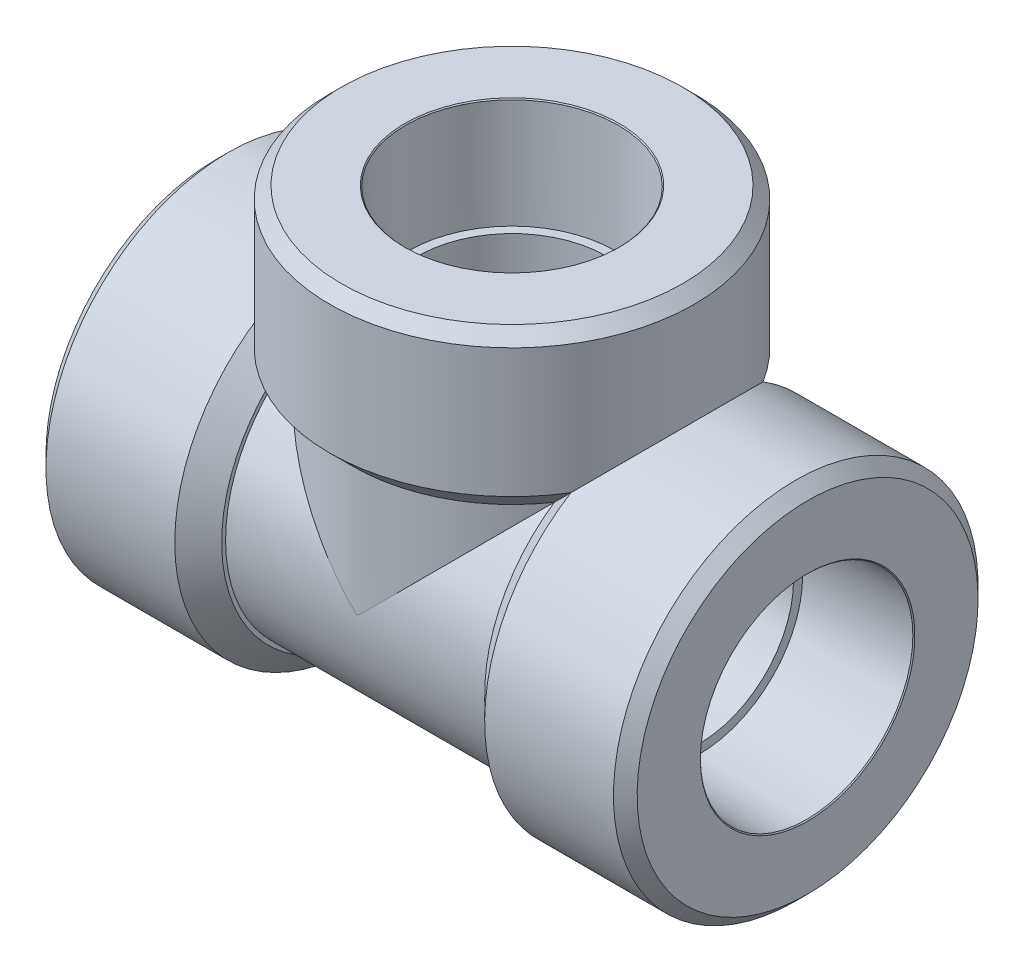
from build123d import *

# Parameters (mm, degrees)
LOFT1_START                 = -38.1
LOFT1_DEPTH                 = 76.2
SKETCH19_R                  = 19.97075
EXTRUDE1_DEPTH              = 38.1
CIRPATTERN1_COUNT           = 3
CIRPATTERN1_ANGLE           = 180
SKETCH10_R                  = 13.335
CUT_EXTRUDE1_DEPTH          = 77.656362587
CUT_EXTRUDE1_DRAFT          = 1.5
SKETCH16_R                  = 12.156586861
CUT_EXTRUDE4_DEPTH          = 24.13
CIRPATTERN2_COUNT           = 3
CIRPATTERN2_ANGLE           = 180
CIRPATTERN2_COPY_1_SKETCH_R = 13.335
CIRPATTERN2_COPY_1_DEPTH    = 77.656362587
CIRPATTERN2_COPY_1_DRAFT    = 1.5
CIRPATTERN2_COPY_2_SKETCH_R = 13.335
CIRPATTERN2_COPY_2_DEPTH    = 77.656362587
CIRPATTERN2_COPY_2_DRAFT    = 1.5


# Read off the part's stored shape, not the designer's step: Loft1
with BuildPart() as part:
    # Loft1 outline → Loft1 (new body)
    with BuildSketch(Plane.YZ.offset(LOFT1_START)):
        with BuildLine():
            add(Edge.make_bspline(
                [(-19.97075, 0), (-19.97075, 2.614165041), (-18.932145195, 7.841465714), (-14.489314141, 14.489697075), (-7.841853874, 18.93146893), (0, 20.491445499), (7.841853874, 18.93146893), (14.489314141, 14.489697075), (18.932145195, 7.841465714), (19.97075, 2.614165041), (19.97075, -2.614165041), (18.932145195, -7.841465714), (14.489314141, -14.489697075), (7.841853874, -18.93146893), (0, -20.491445499), (-7.841853874, -18.93146893), (-14.489314141, -14.489697075), (-18.932145195, -7.841465714), (-19.97075, -2.614165041), (-19.97075, 0)],
                knots=[0, 0, 0, 0, 0.0625, 0.125, 0.1875, 0.25, 0.3125, 0.375, 0.4375, 0.5, 0.5, 0.5625, 0.625, 0.6875, 0.75, 0.8125, 0.875, 0.9375, 1, 1, 1, 1], degree=3))
        make_face()
    extrude(amount=LOFT1_DEPTH)

    # Sketch19 → Extrude1 (add)
    with BuildSketch(Plane(origin=(0, 0, 0), x_dir=(1, 0, 0), z_dir=(0, 1, 0))):
        with Locations(Location((0, 0, 0), (0, 0, 90))):
            Circle(SKETCH19_R)
    extrude(amount=EXTRUDE1_DEPTH)

    # Sketch8 → Revolve1 (revolve)
    with BuildSketch(Plane.XY):
        Polygon((-38.1, 0), (-16.94576875, 0), (-16.94576875, 20.47001875), (-19.97075, 23.495), (-36.572825, 23.495), (-38.1, 21.967825), align=None)
    revolve1 = revolve(axis=Axis((0, 0, 0), (-1, 0, 0)))

    # CirPattern1: Revolve1 ×3 about axis
    cirpattern1_axis = Axis((0, 0, 0), (0, 0, -1))
    for i in range(1, CIRPATTERN1_COUNT):
        add(revolve1.rotate(cirpattern1_axis, i * CIRPATTERN1_ANGLE / (CIRPATTERN1_COUNT - 1)))


with BuildPart() as cut_extrude1_tool:
    # Sketch10 → Cut-Extrude1 (with draft: the straight prism first)
    with BuildSketch(Plane(origin=(-24.13, 0, 0), x_dir=(0, 0, -1), z_dir=(1, 0, 0))):
        Circle(SKETCH10_R)
    extrude(amount=-CUT_EXTRUDE1_DEPTH)
    # Cut-Extrude1: the draft: its side faces are tilted about the plane it starts from
    cut_extrude1_sides = [cut_extrude1_tool.faces().sort_by_distance(p)[0] for p in [
        (-62.958181293, 0, 13.335),
    ]]
    draft(cut_extrude1_sides, Plane(origin=(-24.13, 0, 0), x_dir=(0, 0, -1), z_dir=(1, 0, 0)), CUT_EXTRUDE1_DRAFT)


with BuildPart() as part_1:
    add(part.part)

    # Cut-Extrude1: cut by cut_extrude1_tool
    add(cut_extrude1_tool.part, mode=Mode.SUBTRACT)

    # Cut-Extrude3 cone 1 section (through the dimple's axis) → Cut-Extrude3 (revolve, cut)
    with BuildSketch(Plane(origin=(-38.1, 0, 0), x_dir=(0, 0, 1), z_dir=(0, 1, 0))):
        Polygon((0, 0), (13.827817324, 0), (0, 13.827817324), align=None)
    cut_extrude3 = revolve(axis=Axis((-38.1, 0, 0), (1, 0, 0)), mode=Mode.SUBTRACT)

    # Sketch16 → Cut-Extrude4 (cut)
    with BuildSketch(Plane(origin=(-24.13, 0, 0), x_dir=(0, 0, -1), z_dir=(1, 0, 0))):
        with Locations(Location((0, 0, 0), (0, 0, 180))):
            Circle(SKETCH16_R)
    cut_extrude4 = extrude(amount=CUT_EXTRUDE4_DEPTH, mode=Mode.SUBTRACT)

    # CirPattern2: Cut-Extrude3, Cut-Extrude4 ×3 about axis
    cirpattern2_axis = Axis((0, 0, 0), (0, 0, -1))
    add([cut_extrude3.rotate(cirpattern2_axis, i * CIRPATTERN2_ANGLE / (CIRPATTERN2_COUNT - 1)) for i in range(1, CIRPATTERN2_COUNT)], mode=Mode.SUBTRACT)
    add([cut_extrude4.rotate(cirpattern2_axis, i * CIRPATTERN2_ANGLE / (CIRPATTERN2_COUNT - 1)) for i in range(1, CIRPATTERN2_COUNT)], mode=Mode.SUBTRACT)


with BuildPart() as cirpattern2_copy_1_tool:
    # CirPattern2 copy 1 sketch → CirPattern2 copy 1 (with draft: the straight prism first)
    with BuildSketch(Plane(origin=(0, 24.13, 0), x_dir=(0, 0, -1), z_dir=(0, -1, 0))):
        Circle(CIRPATTERN2_COPY_1_SKETCH_R)
    extrude(amount=-CIRPATTERN2_COPY_1_DEPTH)
    # CirPattern2 copy 1: the draft: its side faces are tilted about the plane it starts from
    cirpattern2_copy_1_sides = [cirpattern2_copy_1_tool.faces().sort_by_distance(p)[0] for p in [
        (0, 62.958181293, 13.335),
    ]]
    draft(cirpattern2_copy_1_sides, Plane(origin=(0, 24.13, 0), x_dir=(0, 0, -1), z_dir=(0, -1, 0)), CIRPATTERN2_COPY_1_DRAFT)


with BuildPart() as part_2:
    add(part_1.part)

    # CirPattern2 copy 1: cut by cirpattern2_copy_1_tool
    add(cirpattern2_copy_1_tool.part, mode=Mode.SUBTRACT)


with BuildPart() as cirpattern2_copy_2_tool:
    # CirPattern2 copy 2 sketch → CirPattern2 copy 2 (with draft: the straight prism first)
    with BuildSketch(Plane(origin=(24.13, 0, 0), x_dir=(0, 0, -1), z_dir=(-1, 0, 0))):
        Circle(CIRPATTERN2_COPY_2_SKETCH_R)
    extrude(amount=-CIRPATTERN2_COPY_2_DEPTH)
    # CirPattern2 copy 2: the draft: its side faces are tilted about the plane it starts from
    cirpattern2_copy_2_sides = [cirpattern2_copy_2_tool.faces().sort_by_distance(p)[0] for p in [
        (62.958181293, 0, 13.335),
    ]]
    draft(cirpattern2_copy_2_sides, Plane(origin=(24.13, 0, 0), x_dir=(0, 0, -1), z_dir=(-1, 0, 0)), CIRPATTERN2_COPY_2_DRAFT)


with BuildPart() as part_3:
    add(part_2.part)

    # CirPattern2 copy 2: cut by cirpattern2_copy_2_tool
    add(cirpattern2_copy_2_tool.part, mode=Mode.SUBTRACT)


solid = part_3.part
